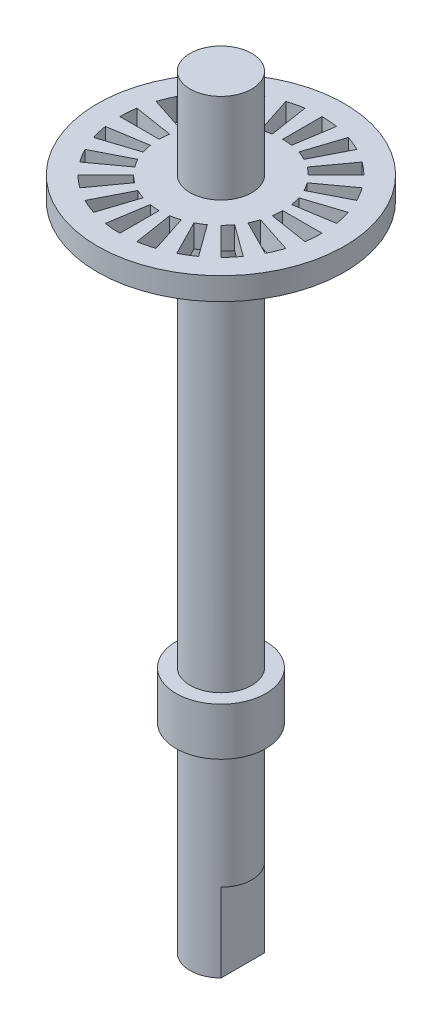
from build123d import *
from build123d.topology import SkipClean

# Parameters (mm, degrees)
SKETCH_1_R          = 2.75
EXTRUDE_1_DEPTH     = 61
EXTRUDE_START       = 7
EXTRUDE_2_DEPTH     = 7
EXTRUDE_START_2     = -22
SKETCH_3_R          = 4
EXTRUDE_3_DEPTH     = 4.25
SKETCH_4_R          = 0.375
CUT_EXTRUDE_1_DEPTH = 5
EXTRUDE_START_3     = -10
SKETCH_6_R          = 11
EXTRUDE_4_DEPTH     = 2


with BuildPart() as part:
    # 草图1 → 凸台-拉伸1 (new body)
    with BuildSketch(Plane(origin=(0, 0, 0), x_dir=(1, 0, 0), z_dir=(0, 1, 0))):
        Circle(SKETCH_1_R)
    extrude(amount=EXTRUDE_1_DEPTH)

    # 草图2 → 凸台-拉伸2 (add)
    with SkipClean():  # the faces are left unmerged after this step: merging them gives an invalid solid
        with BuildSketch(Plane.XZ.offset(EXTRUDE_START)):
            with BuildLine():
                Line((-1.95, 1.939071943), (-1.95, -1.939071943))
                ThreePointArc((-1.95, -1.939071943), (0, -2.75), (1.95, -1.939071943))
                Line((1.95, -1.939071943), (1.95, 1.939071943))
                ThreePointArc((1.95, 1.939071943), (0, 2.75), (-1.95, 1.939071943))
            make_face()
        extrude(amount=-EXTRUDE_2_DEPTH)

    # 草图3 → 凸台-拉伸3 (add)
    with SkipClean():  # the faces are left unmerged after this step: merging them gives an invalid solid
        with BuildSketch(Plane.XZ.offset(7).offset(EXTRUDE_START_2)):
            Circle(SKETCH_3_R)
        extrude(amount=EXTRUDE_3_DEPTH)

    # 草图4 → 切除-拉伸1 (cut, symmetric)
    with SkipClean():  # the faces are left unmerged after this step: merging them gives an invalid solid
        with BuildSketch(Plane.XY):
            with Locations((0, 46.345720238)):
                Circle(SKETCH_4_R)
        extrude(amount=CUT_EXTRUDE_1_DEPTH, both=True, mode=Mode.SUBTRACT)

    # 草图6 → 凸台-拉伸4 (add)
    with SkipClean():  # the faces are left unmerged after this step: merging them gives an invalid solid
        with BuildSketch(Plane(origin=(0, 61, 0), x_dir=(1, 0, 0), z_dir=(0, 1, 0)).offset(EXTRUDE_START_3)):
            Circle(SKETCH_6_R)
            with BuildLine():
                Line((0, 9), (0, 5.5))
                ThreePointArc((0, 5.5), (0.431525027, 5.483045336), (0.860389558, 5.432285873))
                Line((0.860389558, 5.432285873), (1.407910185, 8.889195065))
                ThreePointArc((1.407910185, 8.889195065), (0.706131862, 8.972256004), (0, 9))
            make_face(mode=Mode.SUBTRACT)
            with BuildLine():
                Line((2.781152949, 8.559508647), (1.699593469, 5.23081084))
                ThreePointArc((1.699593469, 5.23081084), (2.104758878, 5.081337429), (2.496947749, 4.900535883))
                Line((2.496947749, 4.900535883), (4.085914498, 8.019058718))
                ThreePointArc((4.085914498, 8.019058718), (3.444150891, 8.314915793), (2.781152949, 8.559508647))
            make_face(mode=Mode.SUBTRACT)
            with BuildLine():
                Line((5.290067271, 7.281152949), (3.232818888, 4.449593469))
                ThreePointArc((3.232818888, 4.449593469), (3.571964266, 4.182232811), (3.889087297, 3.889087297))
                Line((3.889087297, 3.889087297), (6.363961031, 6.363961031))
                ThreePointArc((6.363961031, 6.363961031), (5.845032435, 6.84365369), (5.290067271, 7.281152949))
            make_face(mode=Mode.SUBTRACT)
            with BuildLine():
                Line((7.281152949, 5.290067271), (4.449593469, 3.232818888))
                ThreePointArc((4.449593469, 3.232818888), (4.689520904, 2.873742106), (4.900535883, 2.496947749))
                Line((4.900535883, 2.496947749), (8.019058718, 4.085914498))
                ThreePointArc((8.019058718, 4.085914498), (7.673761479, 4.702487082), (7.281152949, 5.290067271))
            make_face(mode=Mode.SUBTRACT)
            with BuildLine():
                Line((8.559508647, 2.781152949), (5.23081084, 1.699593469))
                ThreePointArc((5.23081084, 1.699593469), (5.348034562, 1.283949501), (5.432285873, 0.860389558))
                Line((5.432285873, 0.860389558), (8.889195065, 1.407910185))
                ThreePointArc((8.889195065, 1.407910185), (8.751329284, 2.101008275), (8.559508647, 2.781152949))
            make_face(mode=Mode.SUBTRACT)
            with BuildLine():
                Line((9, 0), (5.5, 0))
                ThreePointArc((5.5, 0), (5.483045336, -0.431525027), (5.432285873, -0.860389558))
                Line((5.432285873, -0.860389558), (8.889195065, -1.407910185))
                ThreePointArc((8.889195065, -1.407910185), (8.972256004, -0.706131862), (9, 0))
            make_face(mode=Mode.SUBTRACT)
            with BuildLine():
                Line((8.559508647, -2.781152949), (5.23081084, -1.699593469))
                ThreePointArc((5.23081084, -1.699593469), (5.081337429, -2.104758878), (4.900535883, -2.496947749))
                Line((4.900535883, -2.496947749), (8.019058718, -4.085914498))
                ThreePointArc((8.019058718, -4.085914498), (8.314915793, -3.444150891), (8.559508647, -2.781152949))
            make_face(mode=Mode.SUBTRACT)
            with BuildLine():
                Line((7.281152949, -5.290067271), (4.449593469, -3.232818888))
                ThreePointArc((4.449593469, -3.232818888), (4.182232811, -3.571964266), (3.889087297, -3.889087297))
                Line((3.889087297, -3.889087297), (6.363961031, -6.363961031))
                ThreePointArc((6.363961031, -6.363961031), (6.84365369, -5.845032435), (7.281152949, -5.290067271))
            make_face(mode=Mode.SUBTRACT)
            with BuildLine():
                Line((5.290067271, -7.281152949), (3.232818888, -4.449593469))
                ThreePointArc((3.232818888, -4.449593469), (2.873742106, -4.689520904), (2.496947749, -4.900535883))
                Line((2.496947749, -4.900535883), (4.085914498, -8.019058718))
                ThreePointArc((4.085914498, -8.019058718), (4.702487082, -7.673761479), (5.290067271, -7.281152949))
            make_face(mode=Mode.SUBTRACT)
            with BuildLine():
                Line((2.781152949, -8.559508647), (1.699593469, -5.23081084))
                ThreePointArc((1.699593469, -5.23081084), (1.283949501, -5.348034562), (0.860389558, -5.432285873))
                Line((0.860389558, -5.432285873), (1.407910185, -8.889195065))
                ThreePointArc((1.407910185, -8.889195065), (2.101008275, -8.751329284), (2.781152949, -8.559508647))
            make_face(mode=Mode.SUBTRACT)
            with BuildLine():
                Line((0, -9), (0, -5.5))
                ThreePointArc((0, -5.5), (-0.431525027, -5.483045336), (-0.860389558, -5.432285873))
                Line((-0.860389558, -5.432285873), (-1.407910185, -8.889195065))
                ThreePointArc((-1.407910185, -8.889195065), (-0.706131862, -8.972256004), (0, -9))
            make_face(mode=Mode.SUBTRACT)
            with BuildLine():
                Line((-2.781152949, -8.559508647), (-1.699593469, -5.23081084))
                ThreePointArc((-1.699593469, -5.23081084), (-2.104758878, -5.081337429), (-2.496947749, -4.900535883))
                Line((-2.496947749, -4.900535883), (-4.085914498, -8.019058718))
                ThreePointArc((-4.085914498, -8.019058718), (-3.444150891, -8.314915793), (-2.781152949, -8.559508647))
            make_face(mode=Mode.SUBTRACT)
            with BuildLine():
                Line((-5.290067271, -7.281152949), (-3.232818888, -4.449593469))
                ThreePointArc((-3.232818888, -4.449593469), (-3.571964266, -4.182232811), (-3.889087297, -3.889087297))
                Line((-3.889087297, -3.889087297), (-6.363961031, -6.363961031))
                ThreePointArc((-6.363961031, -6.363961031), (-5.845032435, -6.84365369), (-5.290067271, -7.281152949))
            make_face(mode=Mode.SUBTRACT)
            with BuildLine():
                Line((-7.281152949, -5.290067271), (-4.449593469, -3.232818888))
                ThreePointArc((-4.449593469, -3.232818888), (-4.689520904, -2.873742106), (-4.900535883, -2.496947749))
                Line((-4.900535883, -2.496947749), (-8.019058718, -4.085914498))
                ThreePointArc((-8.019058718, -4.085914498), (-7.673761479, -4.702487082), (-7.281152949, -5.290067271))
            make_face(mode=Mode.SUBTRACT)
            with BuildLine():
                Line((-8.559508647, -2.781152949), (-5.23081084, -1.699593469))
                ThreePointArc((-5.23081084, -1.699593469), (-5.348034562, -1.283949501), (-5.432285873, -0.860389558))
                Line((-5.432285873, -0.860389558), (-8.889195065, -1.407910185))
                ThreePointArc((-8.889195065, -1.407910185), (-8.751329284, -2.101008275), (-8.559508647, -2.781152949))
            make_face(mode=Mode.SUBTRACT)
            with BuildLine():
                Line((-9, 0), (-5.5, 0))
                ThreePointArc((-5.5, 0), (-5.483045336, 0.431525027), (-5.432285873, 0.860389558))
                Line((-5.432285873, 0.860389558), (-8.889195065, 1.407910185))
                ThreePointArc((-8.889195065, 1.407910185), (-8.972256004, 0.706131862), (-9, 0))
            make_face(mode=Mode.SUBTRACT)
            with BuildLine():
                Line((-8.559508647, 2.781152949), (-5.23081084, 1.699593469))
                ThreePointArc((-5.23081084, 1.699593469), (-5.081337429, 2.104758878), (-4.900535883, 2.496947749))
                Line((-4.900535883, 2.496947749), (-8.019058718, 4.085914498))
                ThreePointArc((-8.019058718, 4.085914498), (-8.314915793, 3.444150891), (-8.559508647, 2.781152949))
            make_face(mode=Mode.SUBTRACT)
            with BuildLine():
                Line((-7.281152949, 5.290067271), (-4.449593469, 3.232818888))
                ThreePointArc((-4.449593469, 3.232818888), (-4.182232811, 3.571964266), (-3.889087297, 3.889087297))
                Line((-3.889087297, 3.889087297), (-6.363961031, 6.363961031))
                ThreePointArc((-6.363961031, 6.363961031), (-6.84365369, 5.845032435), (-7.281152949, 5.290067271))
            make_face(mode=Mode.SUBTRACT)
            with BuildLine():
                Line((-5.290067271, 7.281152949), (-3.232818888, 4.449593469))
                ThreePointArc((-3.232818888, 4.449593469), (-2.873742106, 4.689520904), (-2.496947749, 4.900535883))
                Line((-2.496947749, 4.900535883), (-4.085914498, 8.019058718))
                ThreePointArc((-4.085914498, 8.019058718), (-4.702487082, 7.673761479), (-5.290067271, 7.281152949))
            make_face(mode=Mode.SUBTRACT)
            with BuildLine():
                Line((-2.781152949, 8.559508647), (-1.699593469, 5.23081084))
                ThreePointArc((-1.699593469, 5.23081084), (-1.283949501, 5.348034562), (-0.860389558, 5.432285873))
                Line((-0.860389558, 5.432285873), (-1.407910185, 8.889195065))
                ThreePointArc((-1.407910185, 8.889195065), (-2.101008275, 8.751329284), (-2.781152949, 8.559508647))
            make_face(mode=Mode.SUBTRACT)
        extrude(amount=EXTRUDE_4_DEPTH)


solid = part.part
